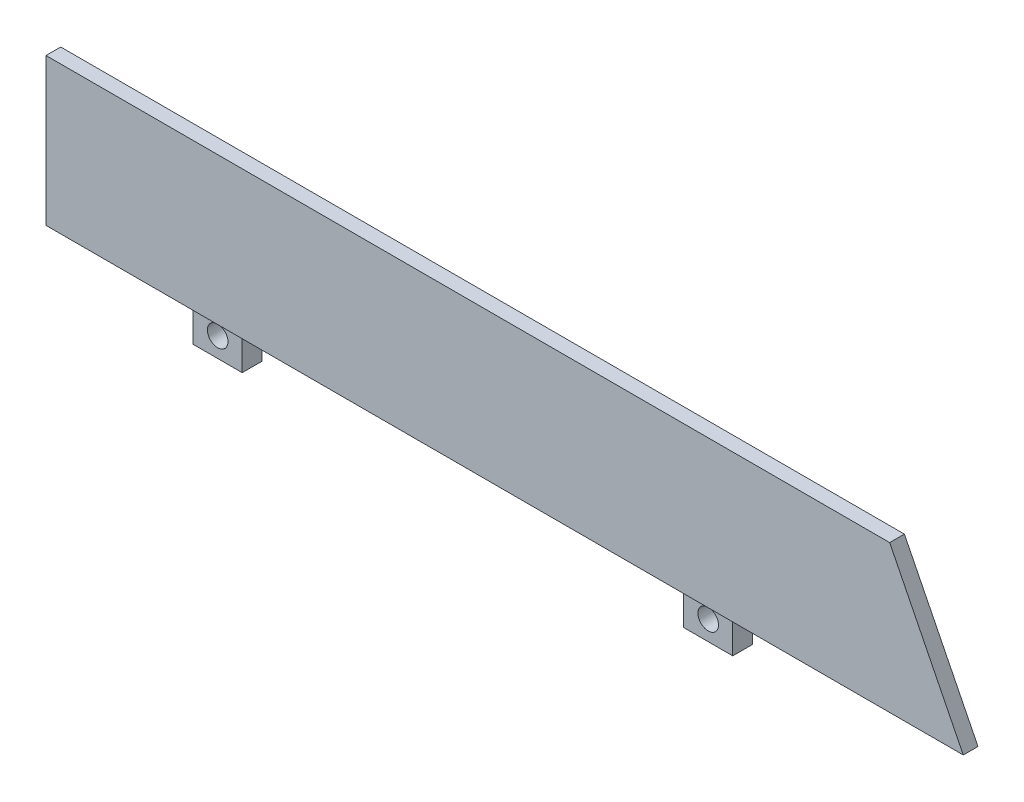
from build123d import *

# Parameters (mm, degrees)
DODANIE_WYCI_GNI_CIE1_DEPTH = 3
SZKIC2_W                    = 10
SZKIC2_H                    = 14
SZKIC2_R                    = 2.1
DODANIE_WYCI_GNI_CIE2_DEPTH = 4
SFAZOWANIE1_SIZE            = 4


with BuildPart() as part:
    # Szkic1 → Dodanie-wyciągnięcie1 (new body)
    with BuildSketch(Plane.XY):
        Polygon((0, 0), (187, 0), (171.996760863, 30), (0, 30), align=None)
    extrude(amount=DODANIE_WYCI_GNI_CIE1_DEPTH)

    # Szkic2 → Dodanie-wyciągnięcie2 (add)
    # profile 1 of 2: a face of its own
    with BuildSketch(Plane(origin=(0, 0, 0), x_dir=(-1, 0, 0), z_dir=(0, 0, -1))):
        with Locations((-132, -2)):
            Rectangle(SZKIC2_W, SZKIC2_H)
        with Locations((-132, -5)):
            Circle(SZKIC2_R, mode=Mode.SUBTRACT)
    # profile 2 of 2: a face of its own
    with BuildSketch(Plane(origin=(0, 0, 0), x_dir=(-1, 0, 0), z_dir=(0, 0, -1))):
        with Locations((-32, -2)):
            Rectangle(SZKIC2_W, SZKIC2_H)
        with Locations((-32, -5)):
            Circle(SZKIC2_R, mode=Mode.SUBTRACT)
    extrude(amount=DODANIE_WYCI_GNI_CIE2_DEPTH)

    # Sfazowanie1
    sfazowanie1_edges = [part.edges().sort_by_distance(p)[0] for p in [
        (37, 2.5, 0),
        (32, 5, 0),
        (27, 2.5, 0),
        (127, 2.5, 0),
        (132, 5, 0),
        (137, 2.5, 0),
    ]]
    chamfer(sfazowanie1_edges, length=SFAZOWANIE1_SIZE - 0.0001)  # a hair under: the kernel refuses the full size


solid = part.part
